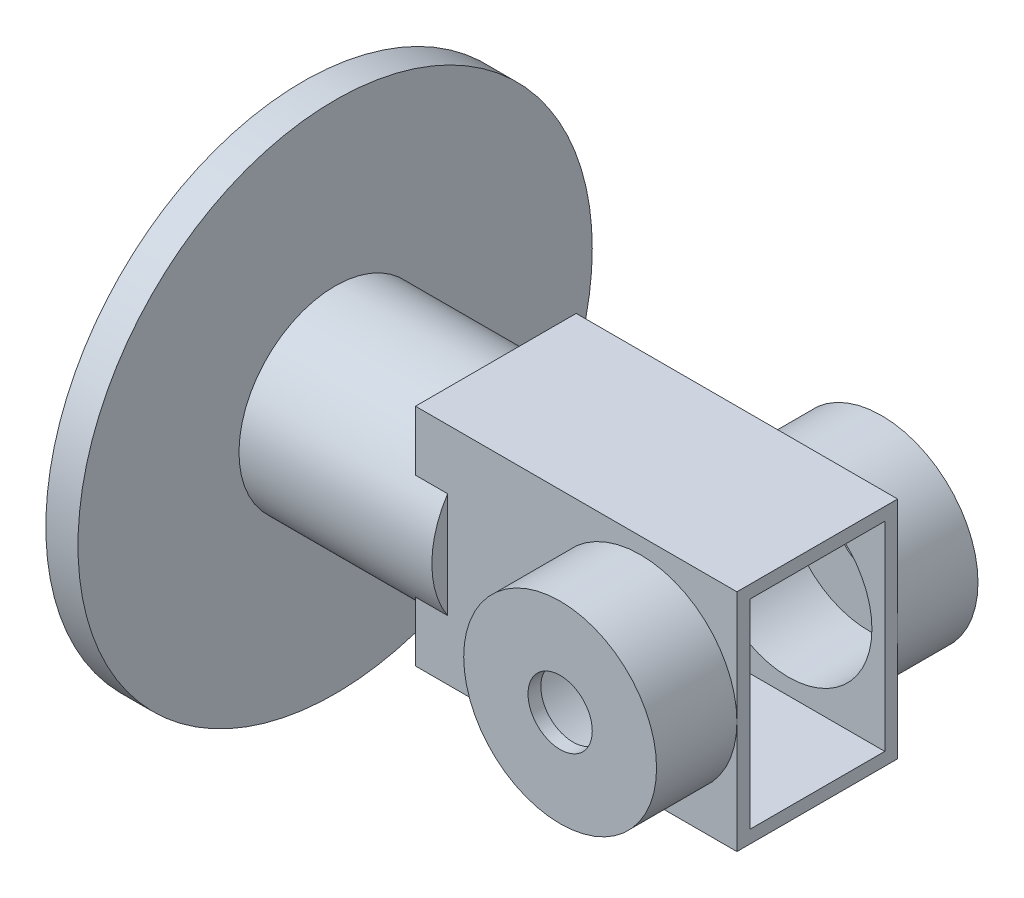
from build123d import *

# Parameters (mm, degrees)
SKETCH1_R                = 40
SKETCH1_R_2              = 5
BOSS_EXTRUDE1_DEPTH      = 5
SKETCH2_R                = 14.954923049
SKETCH2_R_2              = 5
BOSS_EXTRUDE2_DEPTH      = 30
SKETCH3_W                = 25
SKETCH3_H                = 35
BOSS_EXTRUDE3_DEPTH      = 65
BOSS_EXTRUDE4_DEPTH      = 12.5
BOSS_EXTRUDE4_DEPTH_BACK = 37.5
SKETCH4_R                = 15
SKETCH9_R                = 5
CUT_EXTRUDE5_DEPTH       = 111.566721937
SHELL14_START            = 2
SHELL14_OUTLINE_R        = 5
SHELL14_DEPTH            = 91
SHELL14_START_2          = 32
SHELL14_2_DEPTH          = 61
SHELL14_3_OUTLINE_R      = 38
SHELL14_3_DEPTH          = 1
SHELL14_START_3          = 3
SHELL14_4_DEPTH          = 30
SHELL14_START_4          = -23
SHELL14_5_OUTLINE_R      = 13
SHELL14_5_DEPTH          = 46
SKETCH11_R               = 1
CUT_EXTRUDE6_DEPTH       = 5
SKETCH10_R               = 5
CUT_EXTRUDE7_DEPTH       = 122.86057607
SKETCH12_W               = 25
SKETCH12_H               = 35
CUT_EXTRUDE8_DEPTH       = 2
SKETCH16_W               = 32.02314812
SKETCH16_H               = 50.956542264
CUT_EXTRUDE9_DEPTH       = 13


with BuildPart() as part:
    # Sketch1 → Boss-Extrude1 (new body)
    with BuildSketch(Plane(origin=(0, 0, 0), x_dir=(0, 0, -1), z_dir=(1, 0, 0))):
        Circle(SKETCH1_R)
        Circle(SKETCH1_R_2, mode=Mode.SUBTRACT)
    extrude(amount=BOSS_EXTRUDE1_DEPTH)

    # Sketch2 → Boss-Extrude2 (add)
    with BuildSketch(Plane(origin=(5, 0, 0), x_dir=(0, 0, -1), z_dir=(1, 0, 0))):
        Circle(SKETCH2_R)
        Circle(SKETCH2_R_2, mode=Mode.SUBTRACT)
    extrude(amount=BOSS_EXTRUDE2_DEPTH)

    # Sketch3 → Boss-Extrude3 (add)
    with BuildSketch(Plane(origin=(30, 0, 0), x_dir=(0, 0, -1), z_dir=(1, 0, 0))):
        Rectangle(SKETCH3_W, SKETCH3_H)
    extrude(amount=BOSS_EXTRUDE3_DEPTH)

    # Sketch4 → Boss-Extrude4 (add, two sides: drawn at the far end of the back side and taken through both)
    with BuildSketch(Plane(origin=(0, 0, -12.5), x_dir=(-1, 0, 0), z_dir=(0, 0, -1)).offset(-BOSS_EXTRUDE4_DEPTH_BACK)):
        with Locations((-65, 0)):
            Circle(SKETCH4_R)
    extrude(amount=BOSS_EXTRUDE4_DEPTH + BOSS_EXTRUDE4_DEPTH_BACK)

    # Sketch9 → Cut-Extrude5 (cut, through all)
    with BuildSketch(Plane.ZY):
        Circle(SKETCH9_R)
    extrude(amount=-CUT_EXTRUDE5_DEPTH, mode=Mode.SUBTRACT)

    # Shell14: read off the stored shape, not the designer's step
    # Shell14 outline → Shell14 (cut)
    with BuildSketch(Plane.YZ.offset(SHELL14_START)):
        with BuildLine():
            ThreePointArc((7.588150711, -10.5), (12.954923049, 0), (7.588150711, 10.5))
            Line((7.588150711, 10.5), (-7.588150711, 10.5))
            ThreePointArc((-7.588150711, 10.5), (-12.954923049, 0), (-7.588150711, -10.5))
            Line((-7.588150711, -10.5), (7.588150711, -10.5))
        make_face()
        Circle(SHELL14_OUTLINE_R, mode=Mode.SUBTRACT)
    extrude(amount=SHELL14_DEPTH, mode=Mode.SUBTRACT)

    # Shell14 2 outline → Shell14 2 (cut)
    with BuildSketch(Plane.YZ.offset(SHELL14_START_2)):
        with BuildLine():
            ThreePointArc((7.588150711, 10.5), (12.954923049, 0), (7.588150711, -10.5))
            Line((7.588150711, -10.5), (15.5, -10.5))
            Line((15.5, -10.5), (15.5, 10.5))
            Line((15.5, 10.5), (7.588150711, 10.5))
        make_face()
        with BuildLine():
            ThreePointArc((-7.588150711, -10.5), (-12.954923049, 0), (-7.588150711, 10.5))
            Line((-7.588150711, 10.5), (-15.5, 10.5))
            Line((-15.5, 10.5), (-15.5, -10.5))
            Line((-15.5, -10.5), (-7.588150711, -10.5))
        make_face()
    extrude(amount=SHELL14_2_DEPTH, mode=Mode.SUBTRACT)

    # Shell14 3 outline → Shell14 3 (cut)
    with BuildSketch(Plane.YZ.offset(SHELL14_START)):
        Circle(SHELL14_3_OUTLINE_R)
        with BuildLine():
            ThreePointArc((7.588150711, 10.5), (12.954923049, 0), (7.588150711, -10.5))
            Line((7.588150711, -10.5), (-7.588150711, -10.5))
            ThreePointArc((-7.588150711, -10.5), (-12.954923049, 0), (-7.588150711, 10.5))
            Line((-7.588150711, 10.5), (7.588150711, 10.5))
        make_face(mode=Mode.SUBTRACT)
    extrude(amount=SHELL14_3_DEPTH, mode=Mode.SUBTRACT)

    # Shell14 4 outline → Shell14 4 (cut)
    with BuildSketch(Plane.YZ.offset(SHELL14_START_3)):
        with BuildLine():
            Line((-7.588150711, 10.5), (7.588150711, 10.5))
            ThreePointArc((7.588150711, 10.5), (0, 12.954923049), (-7.588150711, 10.5))
        make_face()
        with BuildLine():
            ThreePointArc((-7.588150711, -10.5), (0, -12.954923049), (7.588150711, -10.5))
            Line((7.588150711, -10.5), (-7.588150711, -10.5))
        make_face()
    extrude(amount=SHELL14_4_DEPTH, mode=Mode.SUBTRACT)

    # Shell14 5 outline → Shell14 5 (cut)
    with BuildSketch(Plane.XY.offset(SHELL14_START_4)):
        with Locations((65, 0)):
            Circle(SHELL14_5_OUTLINE_R)
    extrude(amount=SHELL14_5_DEPTH, mode=Mode.SUBTRACT)

    # Sketch11 → Cut-Extrude6 (cut)
    with BuildSketch(Plane.ZY):
        with Locations((0, 7.5)):
            Circle(SKETCH11_R)
        with Locations((7.5, 0)):
            Circle(SKETCH11_R)
        with Locations((0, -7.5)):
            Circle(SKETCH11_R)
        with Locations((-7.5, 0)):
            Circle(SKETCH11_R)
    extrude(amount=-CUT_EXTRUDE6_DEPTH, mode=Mode.SUBTRACT)

    # Sketch10 → Cut-Extrude7 (cut, through all)
    with BuildSketch(Plane.XY.offset(25)):
        with Locations((65, 0)):
            Circle(SKETCH10_R)
    extrude(amount=-CUT_EXTRUDE7_DEPTH, mode=Mode.SUBTRACT)

    # Sketch12 → Cut-Extrude8 (cut)
    with BuildSketch(Plane(origin=(95, 0, 0), x_dir=(0, 0, -1), z_dir=(1, 0, 0))):
        Rectangle(SKETCH12_W, SKETCH12_H)
    extrude(amount=-CUT_EXTRUDE8_DEPTH, mode=Mode.SUBTRACT)

    # Sketch16 → Cut-Extrude9 (cut)
    with BuildSketch(Plane(origin=(93, 0, 0), x_dir=(0, 0, -1), z_dir=(1, 0, 0))):
        with Locations((0.70123682, -2.512765272)):
            Rectangle(SKETCH16_W, SKETCH16_H)
    extrude(amount=-CUT_EXTRUDE9_DEPTH, mode=Mode.SUBTRACT)


solid = part.part
